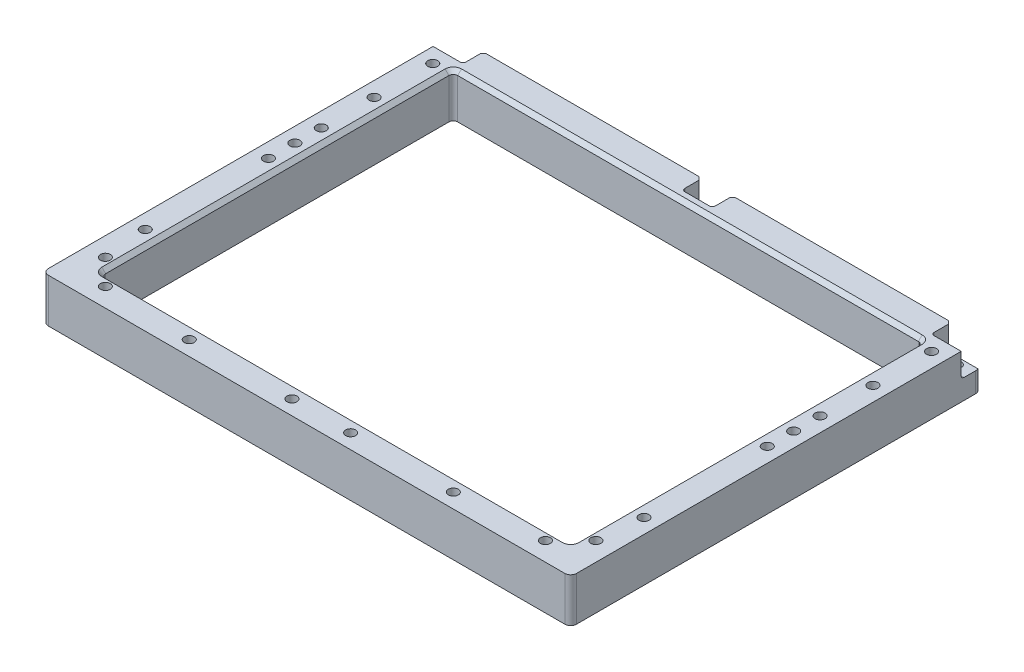
from build123d import *

# Parameters (mm, degrees)
SKETCH1_W                  = 228.6
SKETCH1_H                  = 177.8
SKETCH1_W_2                = 203.2
SKETCH1_H_2                = 152.4
BOSS_EXTRUDE1_DEPTH        = 19.05
SKETCH2_W                  = 12.954
SKETCH2_H                  = 10.414
SKETCH2_W_2                = 13.208
CUT_EXTRUDE1_DEPTH         = 8.763
SKETCH3_R                  = 2.159
CUT_EXTRUDE2_DEPTH         = 6.35
FILLET2_R                  = 1.27
CHAMFER1_SIZE              = 1.27
SKETCH4_R                  = 1.905
CUT_EXTRUDE3_DEPTH         = 7.112
SKETCH5_R                  = 2.159
CUT_EXTRUDE4_DEPTH         = 7.112
FILLET3_R                  = 1.905
SKETCH6_R                  = 2.159
MOTOR_MOUNT_HOLES_DEPTH    = 7.112
CHAMFER2_SIZE              = 1.651
SKETCH7_R                  = 2.159
REARBRACE_MOUNTHOLES_DEPTH = 7.112
SKETCH8_R                  = 2.159
SIDEBRACE_MOUNTHOLES_DEPTH = 7.112
SKETCH9_R                  = 2.159
BATTERYMOUNT_HOLES_DEPTH   = 7.112
FILLET4_R                  = 2.54


with BuildPart() as part:
    # Sketch1 → Boss-Extrude1 (new body)
    with BuildSketch(Plane(origin=(0, 0, 0), x_dir=(1, 0, 0), z_dir=(0, 1, 0))):
        Rectangle(SKETCH1_W, SKETCH1_H)
        Rectangle(SKETCH1_W_2, SKETCH1_H_2, mode=Mode.SUBTRACT)
    extrude(amount=BOSS_EXTRUDE1_DEPTH)

    # Sketch2 → Cut-Extrude1 (cut)
    with BuildSketch(Plane(origin=(0, 0, -88.9), x_dir=(-1, 0, 0), z_dir=(0, 0, -1))):
        with Locations((107.823, 13.843)):
            Rectangle(SKETCH2_W, SKETCH2_H)
        with Locations((0, 13.843)):
            Rectangle(SKETCH2_W_2, SKETCH2_H)
        with Locations((-107.823, 13.843)):
            Rectangle(SKETCH2_W, SKETCH2_H)
    extrude(amount=-CUT_EXTRUDE1_DEPTH, mode=Mode.SUBTRACT)

    # Sketch3 → Cut-Extrude2 (cut)
    with BuildSketch(Plane(origin=(0, 8.636, 0), x_dir=(1, 0, 0), z_dir=(0, 1, 0))):
        with Locations((-107.823, 84.5185)):
            Circle(SKETCH3_R)
        with Locations((0, 84.5185)):
            Circle(SKETCH3_R)
        with Locations((107.823, 84.5185)):
            Circle(SKETCH3_R)
    extrude(amount=-CUT_EXTRUDE2_DEPTH, mode=Mode.SUBTRACT)

    # Fillet2
    fillet2_edges = [part.edges().sort_by_distance(p)[0] for p in [
        (101.346, 8.636, -84.5185),
        (107.823, 8.636, -80.137),
        (-6.604, 8.636, -84.5185),
        (0, 8.636, -80.137),
        (6.604, 8.636, -84.5185),
        (-107.823, 8.636, -80.137),
        (-101.346, 8.636, -84.5185),
        (-101.346, 13.843, -80.137),
        (-6.604, 13.843, -80.137),
        (6.604, 13.843, -80.137),
        (101.346, 13.843, -80.137),
    ]]
    fillet(fillet2_edges, radius=FILLET2_R)

    # Chamfer1
    chamfer1_edges = [part.edges().sort_by_distance(p)[0] for p in [
        (-108.458, 8.636, -88.9),
        (-101.717974388, 9.007974388, -88.9),
        (-101.346, 14.478, -88.9),
        (-6.604, 14.478, -88.9),
        (-6.232025612, 9.007974388, -88.9),
        (0, 8.636, -88.9),
        (6.232025612, 9.007974388, -88.9),
        (6.604, 14.478, -88.9),
        (108.458, 8.636, -88.9),
        (101.717974388, 9.007974388, -88.9),
        (101.346, 14.478, -88.9),
    ]]
    chamfer(chamfer1_edges, length=CHAMFER1_SIZE)

    # Sketch4 → Cut-Extrude3 (cut)
    with BuildSketch(Plane(origin=(0, 0, -88.9), x_dir=(-1, 0, 0), z_dir=(0, 0, -1))):
        with Locations((-20.32, 9.525)):
            Circle(SKETCH4_R)
        with Locations((-81.28, 9.525)):
            Circle(SKETCH4_R)
        with Locations((81.28, 9.525)):
            Circle(SKETCH4_R)
        with Locations((20.32, 9.525)):
            Circle(SKETCH4_R)
    extrude(amount=-CUT_EXTRUDE3_DEPTH, mode=Mode.SUBTRACT)

    # Sketch5 → Cut-Extrude4 (cut)
    with BuildSketch(Plane(origin=(0, 19.05, 0), x_dir=(1, 0, 0), z_dir=(0, 1, 0))):
        with Locations((-95.25, -80.772)):
            Circle(SKETCH5_R)
        with Locations((-106.172, -69.85)):
            Circle(SKETCH5_R)
        with Locations((106.172, -69.85)):
            Circle(SKETCH5_R)
        with Locations((95.25, -80.772)):
            Circle(SKETCH5_R)
    extrude(amount=-CUT_EXTRUDE4_DEPTH, mode=Mode.SUBTRACT)

    # Fillet3
    fillet3_edges = [part.edges().sort_by_distance(p)[0] for p in [
        (-101.6, 9.525, 76.2),
        (101.6, 9.525, 76.2),
        (101.6, 9.525, -76.2),
        (-101.6, 9.525, -76.2),
    ]]
    fillet(fillet3_edges, radius=FILLET3_R)

    # Sketch6 → Motor_Mount_Holes (cut)
    with BuildSketch(Plane(origin=(0, 19.05, 0), x_dir=(1, 0, 0), z_dir=(0, 1, 0))):
        with Locations((107.95, -50.8)):
            Circle(SKETCH6_R)
        with Locations((107.95, 2.54)):
            Circle(SKETCH6_R)
        with Locations((107.95, 13.97)):
            Circle(SKETCH6_R)
        with Locations((107.95, 25.4)):
            Circle(SKETCH6_R)
        with Locations((-107.95, 25.4)):
            Circle(SKETCH6_R)
        with Locations((-107.95, 13.97)):
            Circle(SKETCH6_R)
        with Locations((-107.95, 2.54)):
            Circle(SKETCH6_R)
        with Locations((-107.95, -50.8)):
            Circle(SKETCH6_R)
    extrude(amount=-MOTOR_MOUNT_HOLES_DEPTH, mode=Mode.SUBTRACT)

    # Chamfer2
    chamfer2_edges = [part.edges().sort_by_distance(p)[0] for p in [
        (-101.6, 19.05, 0),
        (-101.042038418, 19.05, 75.642038418),
        (-101.042038418, 19.05, -75.642038418),
        (0, 19.05, 76.2),
        (0, 19.05, -76.2),
        (101.042038418, 19.05, 75.642038418),
        (101.042038418, 19.05, -75.642038418),
        (101.6, 19.05, 0),
    ]]
    chamfer(chamfer2_edges, length=CHAMFER2_SIZE)

    # Sketch7 → RearBrace_MountHoles (cut)
    with BuildSketch(Plane(origin=(0, 19.05, 0), x_dir=(1, 0, 0), z_dir=(0, 1, 0))):
        with Locations((-12.7, -82.55)):
            Circle(SKETCH7_R)
        with Locations((12.7, -82.55)):
            Circle(SKETCH7_R)
    extrude(amount=-REARBRACE_MOUNTHOLES_DEPTH, mode=Mode.SUBTRACT)

    # Sketch8 → SideBrace_MountHoles (cut)
    with BuildSketch(Plane(origin=(0, 19.05, 0), x_dir=(1, 0, 0), z_dir=(0, 1, 0))):
        with Locations((107.95, 73.66)):
            Circle(SKETCH8_R)
        with Locations((107.95, 48.26)):
            Circle(SKETCH8_R)
        with Locations((-107.95, 48.26)):
            Circle(SKETCH8_R)
        with Locations((-107.95, 73.66)):
            Circle(SKETCH8_R)
    extrude(amount=-SIDEBRACE_MOUNTHOLES_DEPTH, mode=Mode.SUBTRACT)

    # Sketch9 → BatteryMount_Holes (cut)
    with BuildSketch(Plane(origin=(0, 19.05, 0), x_dir=(1, 0, 0), z_dir=(0, 1, 0))):
        with Locations((-57.15, -82.55)):
            Circle(SKETCH9_R)
        with Locations((57.15, -82.55)):
            Circle(SKETCH9_R)
    extrude(amount=-BATTERYMOUNT_HOLES_DEPTH, mode=Mode.SUBTRACT)

    # Fillet4
    fillet4_edges = [part.edges().sort_by_distance(p)[0] for p in [
        (-114.3, 3.683, -88.9),
        (114.3, 3.683, -88.9),
        (-114.3, 9.525, 88.9),
        (114.3, 9.525, 88.9),
    ]]
    fillet(fillet4_edges, radius=FILLET4_R)


solid = part.part
